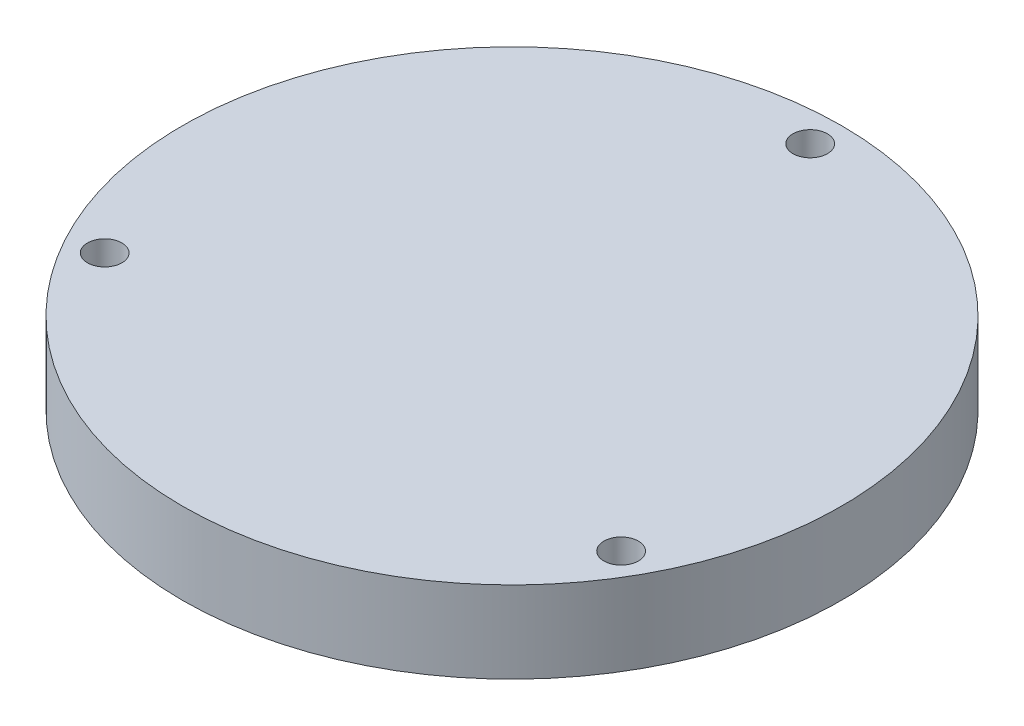
from build123d import *

# Parameters (mm, degrees)
ESQUISSE1_R             = 52.5
BOSS_EXTRU_1_DEPTH      = 10
ESQUISSE2_R             = 52.5
BOSS_EXTRU_2_DEPTH      = 3
ENL_V_START             = -3
ESQUISSE3_R             = 2.75
ENL_V_MAT_EXTRU_2_DEPTH = 73.375725535
ESQUISSE4_R             = 1.55
ENL_V_MAT_EXTRU_3_DEPTH = 76.375725535


with BuildPart() as part:
    # Esquisse1 → Boss.-Extru.1 (new body)
    with BuildSketch(Plane(origin=(0, 0, 0), x_dir=(1, 0, 0), z_dir=(0, 1, 0))):
        Circle(ESQUISSE1_R)
        with BuildLine():
            ThreePointArc((-4, 47.5), (0, 43.5), (4, 47.5))
            Line((4, 47.5), (4, 48.127435003))
            ThreePointArc((4, 48.127435003), (4.676150568, 49.626575651), (6.24742268, 50.112071498))
            ThreePointArc((6.24742268, 50.112071498), (43.734282891, 25.25), (46.522038294, -19.645609))
            ThreePointArc((46.522038294, -19.645609), (45.3159505, -20.763622642), (43.679581332, -20.599615887))
            Line((43.679581332, -20.599615887), (43.13620668, -20.285898385))
            ThreePointArc((43.13620668, -20.285898385), (37.672105065, -21.75), (39.13620668, -27.214101615))
            Line((39.13620668, -27.214101615), (39.679581332, -27.527819117))
            ThreePointArc((39.679581332, -27.527819117), (40.639799932, -28.862953009), (40.274615614, -30.466462499))
            ThreePointArc((40.274615614, -30.466462499), (0, -50.5), (-40.274615614, -30.466462499))
            ThreePointArc((-40.274615614, -30.466462499), (-40.639799932, -28.862953009), (-39.679581332, -27.527819117))
            Line((-39.679581332, -27.527819117), (-39.13620668, -27.214101615))
            ThreePointArc((-39.13620668, -27.214101615), (-37.672105065, -21.75), (-43.13620668, -20.285898385))
            Line((-43.13620668, -20.285898385), (-43.679581332, -20.599615887))
            ThreePointArc((-43.679581332, -20.599615887), (-45.3159505, -20.763622642), (-46.522038294, -19.645609))
            ThreePointArc((-46.522038294, -19.645609), (-43.734282891, 25.25), (-6.24742268, 50.112071498))
            ThreePointArc((-6.24742268, 50.112071498), (-4.676150568, 49.626575651), (-4, 48.127435003))
            Line((-4, 48.127435003), (-4, 47.5))
        make_face(mode=Mode.SUBTRACT)
    extrude(amount=BOSS_EXTRU_1_DEPTH)

    # Esquisse2 → Boss.-Extru.2 (add)
    with BuildSketch(Plane(origin=(0, 10, 0), x_dir=(1, 0, 0), z_dir=(0, 1, 0))):
        Circle(ESQUISSE2_R)
    extrude(amount=BOSS_EXTRU_2_DEPTH)

    # Esquisse3 → Enlèv. mat.-Extru.2 (cut, through all)
    with BuildSketch(Plane.XZ.offset(ENL_V_START)):
        with Locations((0, -47.5)):
            Circle(ESQUISSE3_R)
        with Locations((-41.13620668, 23.75)):
            Circle(ESQUISSE3_R)
        with Locations((41.13620668, 23.75)):
            Circle(ESQUISSE3_R)
    extrude(amount=-ENL_V_MAT_EXTRU_2_DEPTH, mode=Mode.SUBTRACT)

    # Esquisse4 → Enlèv. mat.-Extru.3 (cut, through all)
    with BuildSketch(Plane.XZ):
        with Locations((0, -47.5)):
            Circle(ESQUISSE4_R)
        with Locations((-41.13620668, 23.75)):
            Circle(ESQUISSE4_R)
        with Locations((41.13620668, 23.75)):
            Circle(ESQUISSE4_R)
    extrude(amount=-ENL_V_MAT_EXTRU_3_DEPTH, mode=Mode.SUBTRACT)


solid = part.part
